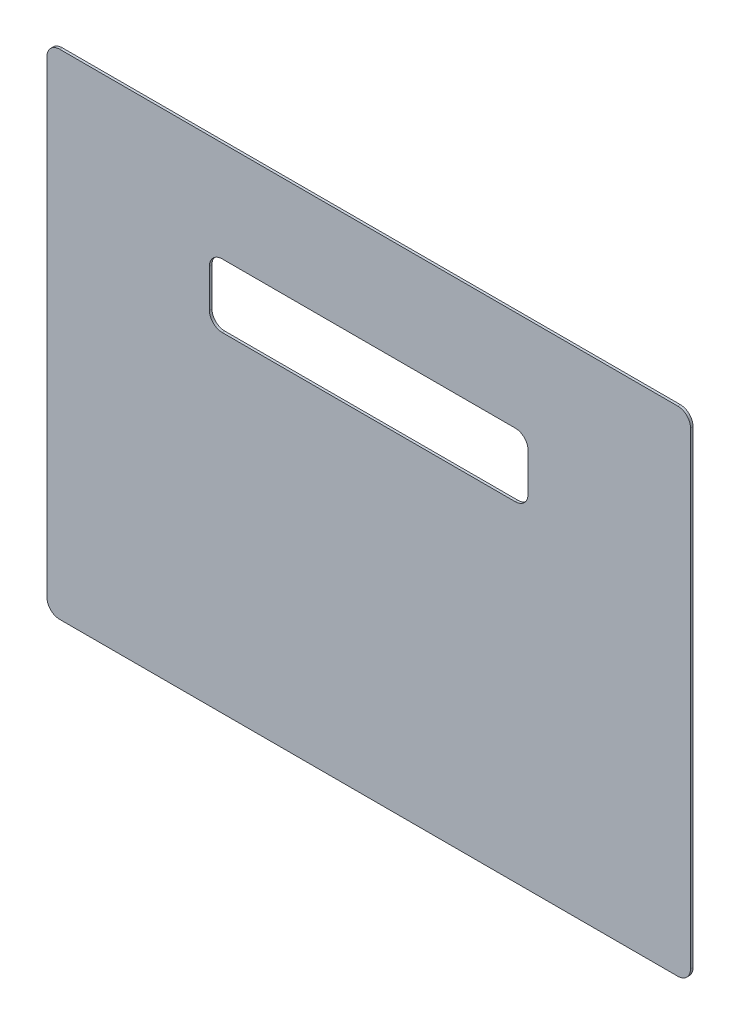
from build123d import *

# Parameters (mm, degrees)
SKETCH1_W           = 1010
SKETCH1_H           = 775
BOSS_EXTRUDE1_DEPTH = 4
FILLET1_R           = 20
SKETCH2_W           = 500
SKETCH2_H           = 100
CUT_EXTRUDE1_DEPTH  = 10
FILLET2_R           = 20


with BuildPart() as part:
    # Sketch1 → Boss-Extrude1 (new body)
    with BuildSketch(Plane.XY):
        Rectangle(SKETCH1_W, SKETCH1_H)
    extrude(amount=BOSS_EXTRUDE1_DEPTH)

    # Fillet1
    fillet1_edges = [part.edges().sort_by_distance(p)[0] for p in [
        (-505, -387.5, 2),
        (-505, 387.5, 2),
        (505, 387.5, 2),
        (505, -387.5, 2),
    ]]
    fillet(fillet1_edges, radius=FILLET1_R)

    # Sketch2 → Cut-Extrude1 (cut)
    with BuildSketch(Plane.XY.offset(4)):
        with Locations((0, 180)):
            Rectangle(SKETCH2_W, SKETCH2_H)
    extrude(amount=-CUT_EXTRUDE1_DEPTH, mode=Mode.SUBTRACT)

    # Fillet2
    fillet2_edges = [part.edges().sort_by_distance(p)[0] for p in [
        (-250, 130, 2),
        (-250, 230, 2),
        (250, 130, 2),
        (250, 230, 2),
    ]]
    fillet(fillet2_edges, radius=FILLET2_R)


solid = part.part
